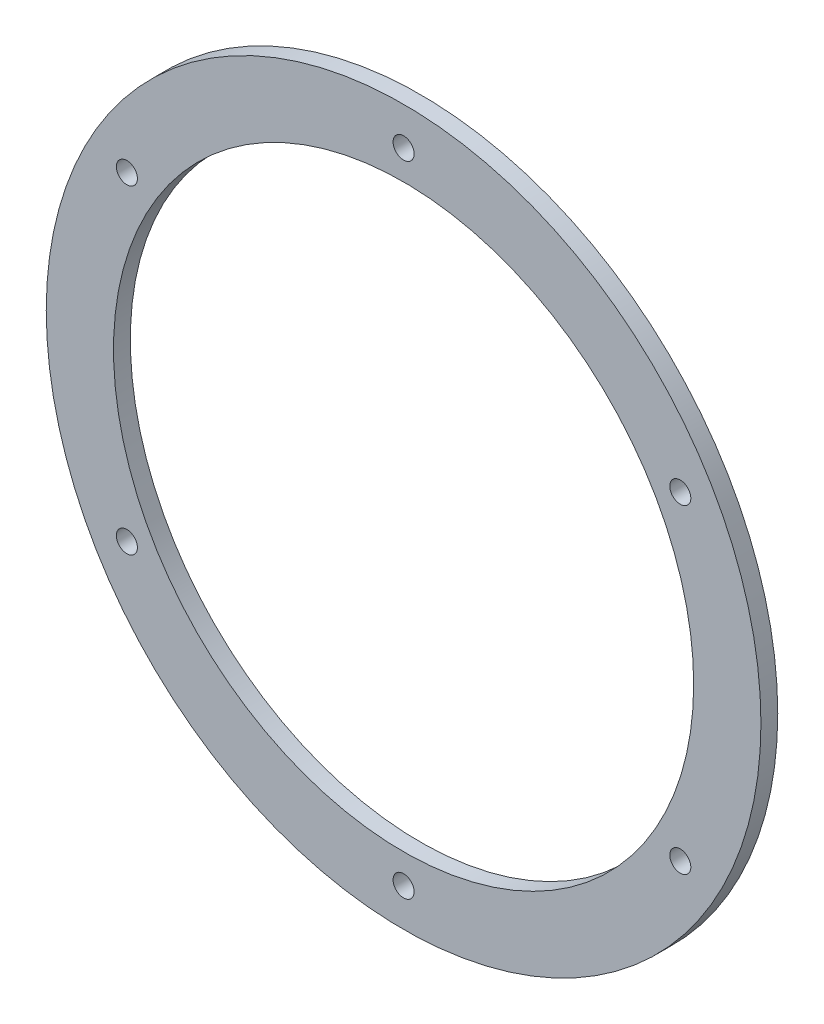
from build123d import *

# Parameters (mm, degrees)
SKETCH_1_R                 = 42.5
SKETCH_1_R_2               = 34.5
EXTRUDE_336_DEPTH          = 2
SKETCH_3_R                 = 1.25
CUT_EXTRUDE_486_DEPTH      = 61.137342808
PATTERN_CIRCULAR_525_COUNT = 6


with BuildPart() as part:
    # Эскиз1 → Extrude 336 (new body)
    with BuildSketch(Plane.XY):
        Circle(SKETCH_1_R)
        Circle(SKETCH_1_R_2, mode=Mode.SUBTRACT)
    extrude(amount=EXTRUDE_336_DEPTH)

    # Эскиз3 → Cut-Extrude 486 (cut, through all)
    with BuildSketch(Plane.XY.offset(2)):
        with Locations((0, 38)):
            Circle(SKETCH_3_R)
    cut_extrude_486 = extrude(amount=-CUT_EXTRUDE_486_DEPTH, mode=Mode.SUBTRACT)

    # Pattern Circular 525: Cut-Extrude 486 ×6 about axis
    pattern_circular_525_axis = Axis((0, 0, 2), (0, 0, -1))
    for i in range(1, PATTERN_CIRCULAR_525_COUNT):
        add(cut_extrude_486.rotate(pattern_circular_525_axis, i * 360 / PATTERN_CIRCULAR_525_COUNT), mode=Mode.SUBTRACT)


solid = part.part
